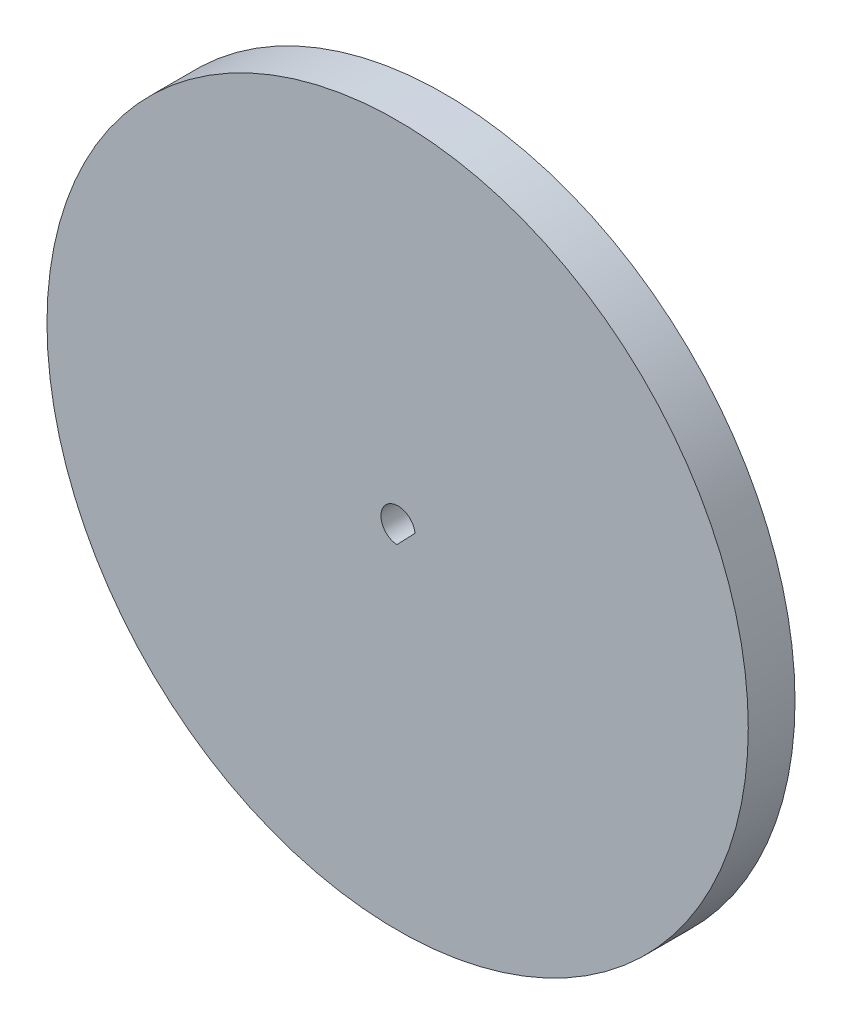
from build123d import *

# Parameters (mm, degrees)
SKETCH1_R           = 40
BOSS_EXTRUDE1_DEPTH = 5.334
CUT_EXTRUDE1_DEPTH  = 73.172531324


with BuildPart() as part:
    # Sketch1 → Boss-Extrude1 (new body)
    with BuildSketch(Plane.XY):
        with Locations((-10.991688671, 10.796362155)):
            Circle(SKETCH1_R)
    extrude(amount=BOSS_EXTRUDE1_DEPTH)

    # Sketch2 → Cut-Extrude1 (cut, through all)
    with BuildSketch(Plane.XY.offset(5.334)):
        with BuildLine():
            ThreePointArc((-9.007270059, 11.02275126), (-12.354055355, 12.153692541), (-11.076699611, 8.860007325))
            Line((-11.076699611, 8.860007325), (-9.007270059, 11.02275126))
        make_face()
    extrude(amount=-CUT_EXTRUDE1_DEPTH, mode=Mode.SUBTRACT)


solid = part.part
